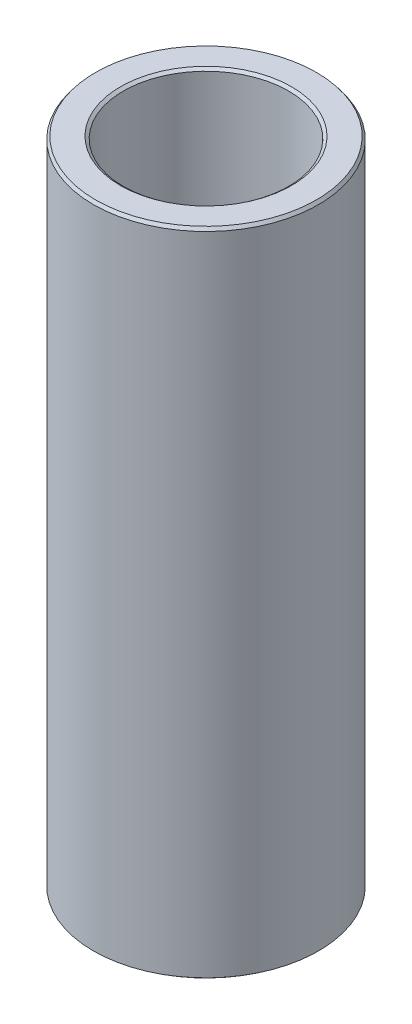
from build123d import *
from OCP.BRepFilletAPI import BRepFilletAPI_MakeChamfer

# Parameters (mm, degrees)
SKETCH1_R           = 47.5
BOSS_EXTRUDE1_DEPTH = 274.748979283
SKETCH2_R           = 34.854442031
CUT_EXTRUDE1_DEPTH  = 283.841831448
CHAMFER1_SIZE       = 1.244761041
CHAMFER1_SIZE2      = 0.927045196


with BuildPart() as part:
    # Sketch1 → Boss-Extrude1 (new body)
    with BuildSketch(Plane(origin=(0, 0, 0), x_dir=(1, 0, 0), z_dir=(0, 1, 0))):
        Circle(SKETCH1_R)
    extrude(amount=BOSS_EXTRUDE1_DEPTH)

    # Sketch2 → Cut-Extrude1 (cut, through all)
    with BuildSketch(Plane(origin=(0, 0, 0), x_dir=(1, 0, 0), z_dir=(0, 1, 0))):
        Circle(SKETCH2_R)
    extrude(amount=CUT_EXTRUDE1_DEPTH, mode=Mode.SUBTRACT)

    # Chamfer1: one chamfer whose edges measure the first distance from different faces: ONE call of the kernel's chamfer builder (chamfer() names one face for all edges)
    chamfer1_edges_1 = [part.edges().sort_by_distance(p)[0] for p in [
        (-34.854442031, 274.748979283, 0),
    ]]
    chamfer1_side_1 = [part.faces().sort_by_distance(p)[0] for p in [
        (-46.156497116, 274.748979283, 0),
    ]]
    chamfer1_edges_2 = [part.edges().sort_by_distance(p)[0] for p in [
        (-34.854442031, 0, 0),
    ]]
    chamfer1_side_2 = [part.faces().sort_by_distance(p)[0] for p in [
        (-34.854442031, 137.374489641, 0),
    ]]
    chamfer1_edges_3 = [part.edges().sort_by_distance(p)[0] for p in [
        (-47.5, 0, 0),
    ]]
    chamfer1_side_3 = [part.faces().sort_by_distance(p)[0] for p in [
        (-46.156497116, 0, 0),
    ]]
    chamfer1_edges_4 = [part.edges().sort_by_distance(p)[0] for p in [
        (-47.5, 274.748979283, 0),
    ]]
    chamfer1_side_4 = [part.faces().sort_by_distance(p)[0] for p in [
        (-47.5, 137.374489641, 0),
    ]]
    chamfer1 = BRepFilletAPI_MakeChamfer(part.part.solid().wrapped)
    for e in chamfer1_edges_1:
        chamfer1.Add(CHAMFER1_SIZE, CHAMFER1_SIZE2, e.wrapped, chamfer1_side_1[0].wrapped)  # the first distance lies on this face
    for e in chamfer1_edges_2:
        chamfer1.Add(CHAMFER1_SIZE, CHAMFER1_SIZE2, e.wrapped, chamfer1_side_2[0].wrapped)  # the first distance lies on this face
    for e in chamfer1_edges_3:
        chamfer1.Add(CHAMFER1_SIZE, CHAMFER1_SIZE2, e.wrapped, chamfer1_side_3[0].wrapped)  # the first distance lies on this face
    for e in chamfer1_edges_4:
        chamfer1.Add(CHAMFER1_SIZE, CHAMFER1_SIZE2, e.wrapped, chamfer1_side_4[0].wrapped)  # the first distance lies on this face
    add(Compound.cast(chamfer1.Shape()), mode=Mode.REPLACE)


solid = part.part
